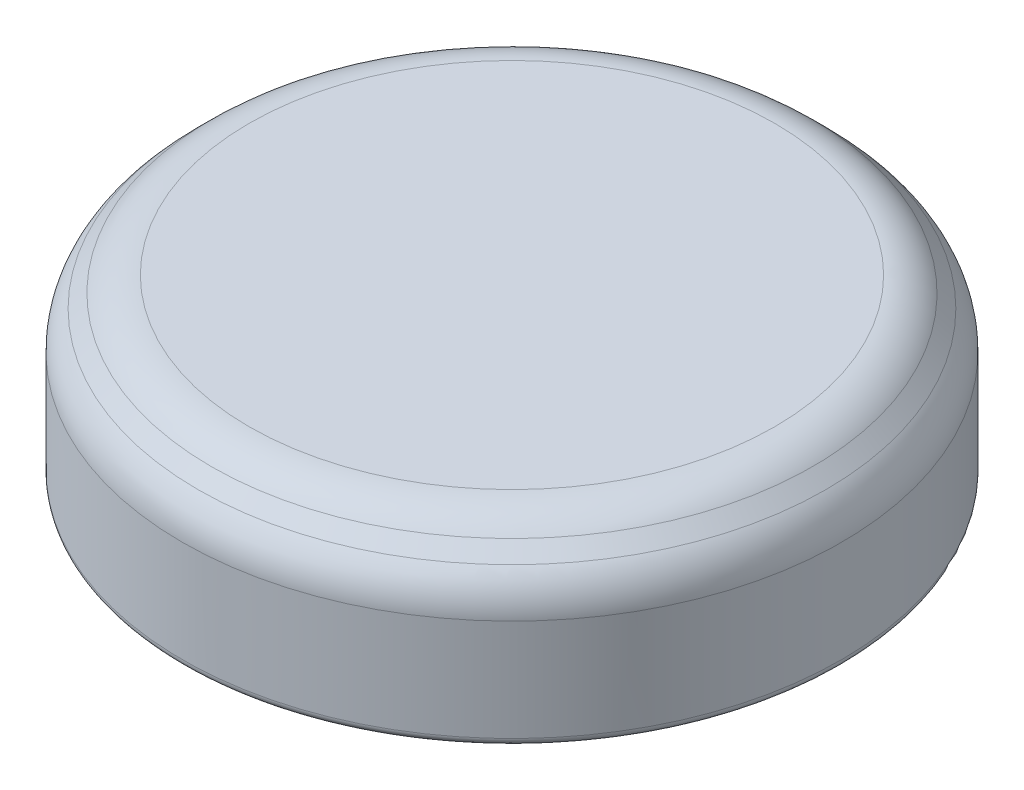
from build123d import *

# Parameters (mm, degrees)
SKETCH1_R           = 14.6431
BOSS_EXTRUDE1_DEPTH = 7.366
FILLET1_SIZE        = 1.524
SHELL1_T            = 1.016
SKETCH2_W           = 5.08
SKETCH2_H           = 3.048
CUT_EXTRUDE1_DEPTH  = 25.4
FILLET2_R           = 0.381
SNAP_START          = 14.621716272
SNAP_GROOVE1_DEPTH  = 0.567483728
CIRPATTERN2_COUNT   = 4
FILLET3_R           = 2.54
FILLET4_R           = 2.54


# Read off the part's stored shape, not the designer's step: Snap Groove1
with BuildPart() as part:
    # Sketch1 → Boss-Extrude1 (new body)
    with BuildSketch(Plane(origin=(0, 0, 0), x_dir=(1, 0, 0), z_dir=(0, 1, 0))):
        with Locations(Location((0, 0, 0), (0, 0, 270))):
            Circle(SKETCH1_R)
    extrude(amount=BOSS_EXTRUDE1_DEPTH)

    # Fillet1
    fillet1_edges = [part.edges().sort_by_distance(p)[0] for p in [
        (0, 7.366, -14.6431),
    ]]
    chamfer(fillet1_edges, length=FILLET1_SIZE)

    # Shell1
    shell1_openings = [part.faces().sort_by_distance(p)[0] for p in [
        (0, 0, 0),
    ]]
    offset(amount=SHELL1_T, openings=shell1_openings, kind=Kind.INTERSECTION)

    # Sketch2 → Cut-Extrude1 (cut)
    with BuildSketch(Plane.XY):
        with Locations((0, 1.524)):
            Rectangle(SKETCH2_W, SKETCH2_H)
    extrude(amount=-CUT_EXTRUDE1_DEPTH, mode=Mode.SUBTRACT)

    # Fillet2
    fillet2_edges = [part.edges().sort_by_distance(p)[0] for p in [
        (15.607170203, 0, 1.274225676),
    ]]
    fillet(fillet2_edges, radius=FILLET2_R)

    # Snap Groove1 outline → Snap Groove1 (cut)
    with BuildSketch(Plane.XY.offset(SNAP_START)):
        Polygon((-0.707206527, 5.6642), (-0.791069456, 4.064), (0.791069456, 4.064), (0.707206527, 5.6642), align=None)
    snap_groove1 = extrude(amount=SNAP_GROOVE1_DEPTH, mode=Mode.SUBTRACT)

    # CirPattern2: Snap Groove1 ×4 about axis
    cirpattern2_axis = Axis((0, 0, 0), (0, 1, 0))
    for i in range(1, CIRPATTERN2_COUNT):
        add(snap_groove1.rotate(cirpattern2_axis, i * 360 / CIRPATTERN2_COUNT), mode=Mode.SUBTRACT)

    # Fillet3
    fillet3_edges = [part.edges().sort_by_distance(p)[0] for p in [
        (0, 8.382, -13.539940979),
    ]]
    fillet(fillet3_edges, radius=FILLET3_R)

    # Fillet4
    fillet4_edges = [part.edges().sort_by_distance(p)[0] for p in [
        (0, 6.262840979, -15.6591),
    ]]
    fillet(fillet4_edges, radius=FILLET4_R)


solid = part.part
